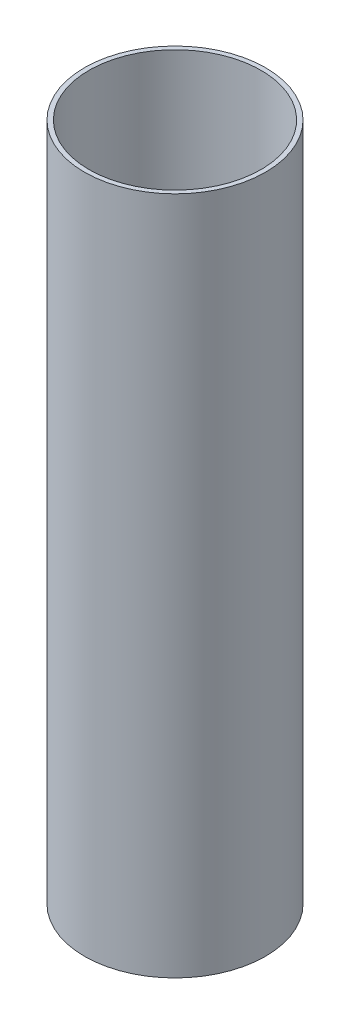
from build123d import *

# Parameters (mm, degrees)
SKETCH1_R           = 40
SKETCH1_R_2         = 38
BOSS_EXTRUDE1_DEPTH = 300


with BuildPart() as part:
    # Sketch1 → Boss-Extrude1 (new body)
    with BuildSketch(Plane(origin=(0, 0, 0), x_dir=(1, 0, 0), z_dir=(0, 1, 0))):
        Circle(SKETCH1_R)
        Circle(SKETCH1_R_2, mode=Mode.SUBTRACT)
    extrude(amount=BOSS_EXTRUDE1_DEPTH)


solid = part.part
